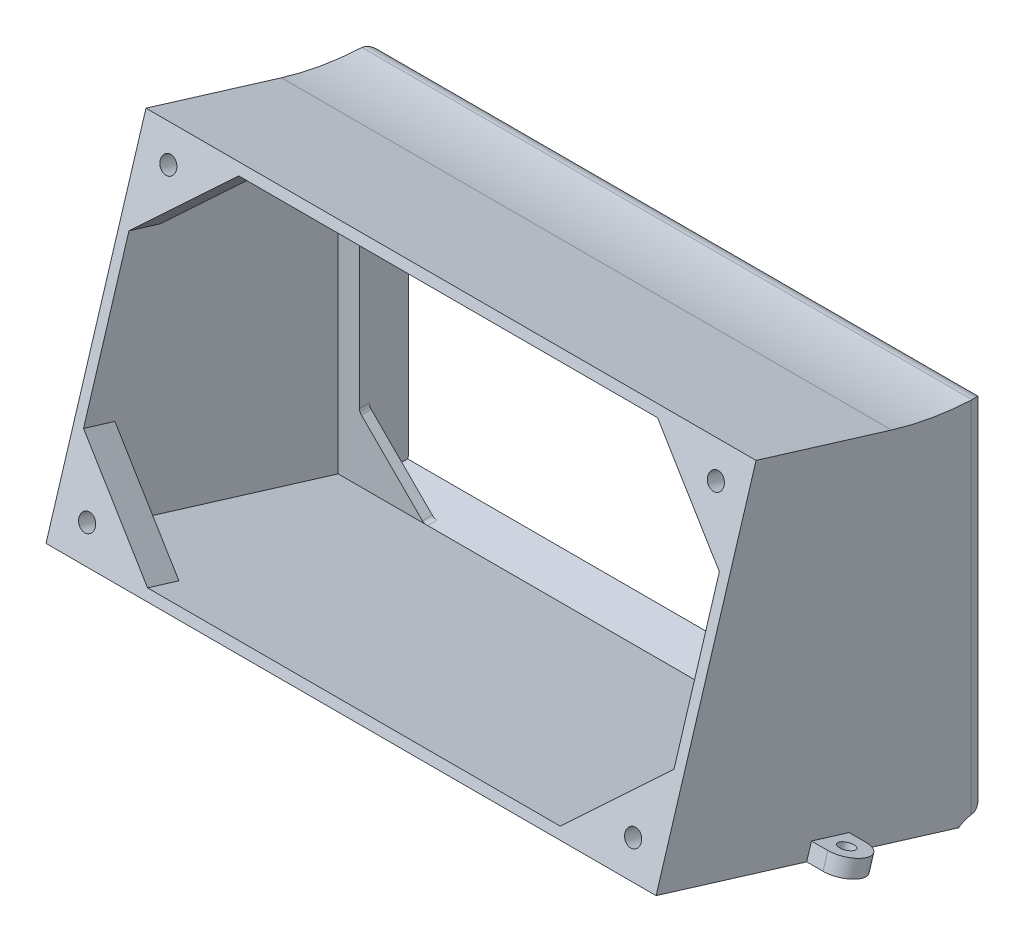
from build123d import *

# Parameters (mm, degrees)
SKETCH1_W                = 173
SKETCH1_H                = 109
SKETCH1_W_2              = 167
SKETCH1_H_2              = 103
EXTRUDE_THIN1_DEPTH      = 15
BOSS_EXTRUDE1_DEPTH      = 3
BOSS_EXTRUDE2_DEPTH      = 86.5
BOSS_EXTRUDE2_DEPTH_BACK = 86.5
MOVE_START               = 86.5
MOVE_FACE1_DEPTH         = 6.5
MOVE_START_2             = -93
MOVE_FACE2_DEPTH         = 6.5
BOSS_EXTRUDE3_START      = -93
BOSS_EXTRUDE3_DEPTH      = 186
BOSS_EXTRUDE3_2_DEPTH    = 3
BOSS_EXTRUDE3_START_2    = 90
BOSS_EXTRUDE3_3_DEPTH    = 3
FILLET3_R                = 100
FILLET2_R                = 2
SKETCH8_R                = 2.5
BOSS_EXTRUDE4_DEPTH      = 10
SKETCH8_3_R              = 2.5
CUT_EXTRUDE1_DEPTH       = 6
SKETCH9_R                = 2.25
BOSS_EXTRUDE5_DEPTH      = 5
FILLET4_R                = 5


# Read off the part's stored shape, not the designer's step: Move Face1, Move Face2, Boss-Extrude3
with BuildPart() as part:
    # Sketch1 → Extrude-Thin1 (new body)
    with BuildSketch(Plane.XY):
        Rectangle(SKETCH1_W, SKETCH1_H)
        Rectangle(SKETCH1_W_2, SKETCH1_H_2, mode=Mode.SUBTRACT)
    extrude(amount=EXTRUDE_THIN1_DEPTH)

    # Sketch2 → Boss-Extrude1 (add)
    with BuildSketch(Plane.XY.offset(15)):
        Polygon((63.701010127, 51.5), (83.5, 31.701010127), (83.5, 51.5), align=None)
        Polygon((-83.5, 51.5), (-83.5, 31.701010127), (-63.701010127, 51.5), align=None)
        Polygon((83.5, -31.701010127), (63.701010127, -51.5), (83.5, -51.5), align=None)
        Polygon((-83.5, -31.701010127), (-83.5, -51.5), (-63.701010127, -51.5), align=None)
    extrude(amount=-BOSS_EXTRUDE1_DEPTH)

    # Sketch5 → Boss-Extrude2 (add, two sides: drawn at the far end of the back side and taken through both)
    with BuildSketch(Plane(origin=(0, 0, 0), x_dir=(0, 0, -1), z_dir=(1, 0, 0)).offset(-BOSS_EXTRUDE2_DEPTH_BACK)):
        with BuildLine():
            Line((-15, -54.5), (-8.784019086, -56.400416081))
            add(Edge.make_bspline(
                [(0, -54.5), (-2.80635361, -54.592909142), (-6.451217818, -54.49036495), (-8.784019086, -56.400416081)],
                knots=[0, 0, 0, 0, 1, 1, 1, 1], degree=3))
            Line((0, -54.5), (-15, -54.5))
        make_face()
    extrude(amount=BOSS_EXTRUDE2_DEPTH + BOSS_EXTRUDE2_DEPTH_BACK)

    # Move Face1 outline → Move Face1 (add)
    with BuildSketch(Plane.YZ.offset(MOVE_START)):
        with BuildLine():
            Line((-54.5, 15), (-56.400416081, 8.784019086))
            add(Edge.make_bspline(
                [(-56.400416081, 8.784019086), (-54.49036495, 6.451217818), (-54.592909142, 2.80635361), (-54.5, 0)],
                knots=[0, 0, 0, 0, 1, 1, 1, 1], degree=3))
            Line((-54.5, 0), (54.5, 0))
            Line((54.5, 0), (54.5, 15))
            Line((54.5, 15), (-54.5, 15))
        make_face()
    extrude(amount=MOVE_FACE1_DEPTH)

    # Move Face2 outline → Move Face2 (add)
    with BuildSketch(Plane.YZ.offset(MOVE_START_2)):
        with BuildLine():
            Line((-54.5, 15), (-56.400416081, 8.784019086))
            add(Edge.make_bspline(
                [(-56.400416081, 8.784019086), (-54.49036495, 6.451217818), (-54.592909142, 2.80635361), (-54.5, 0)],
                knots=[0, 0, 0, 0, 1, 1, 1, 1], degree=3))
            Line((-54.5, 0), (54.5, 0))
            Line((54.5, 0), (54.5, 15))
            Line((54.5, 15), (-54.5, 15))
        make_face()
    extrude(amount=MOVE_FACE2_DEPTH)

    # Boss-Extrude3 outline → Boss-Extrude3 (add)
    with BuildSketch(Plane.YZ.offset(BOSS_EXTRUDE3_START)):
        Polygon((-28.186546575, 101.067428037), (-54.5, 15), (-51.362924731, 15), (-25.317632307, 100.190312923), align=None)
        Polygon((71.496001129, 70.591414798), (68.627086861, 71.468529912), (51.362924731, 15), (54.5, 15), align=None)
    extrude(amount=BOSS_EXTRUDE3_DEPTH)

    # Boss-Extrude3 2 outline → Boss-Extrude3 2 (add)
    with BuildSketch(Plane.YZ.offset(BOSS_EXTRUDE3_START)):
        Polygon((68.627086861, 71.468529912), (-25.317632307, 100.190312923), (-51.362924731, 15), (51.362924731, 15), align=None)
    extrude(amount=BOSS_EXTRUDE3_2_DEPTH)

    # Boss-Extrude3 3 outline → Boss-Extrude3 3 (add)
    with BuildSketch(Plane.YZ.offset(BOSS_EXTRUDE3_START_2)):
        Polygon((68.627086861, 71.468529912), (-25.317632307, 100.190312923), (-51.362924731, 15), (51.362924731, 15), align=None)
    extrude(amount=BOSS_EXTRUDE3_3_DEPTH)

    # Fillet3
    fillet3_edges = [part.edges().sort_by_distance(p)[0] for p in [
        (0, 54.5, 15),
    ]]
    fillet(fillet3_edges, radius=FILLET3_R)

    # Fillet2
    # the kernel refuses this fillet: 2 mm, written as the material it adds along each edge
    with BuildSketch(Plane(origin=(83.5, 31.701010127, 15), x_dir=(0, -1, 0), z_dir=(0, 0, -1)), Plane(origin=(-63.701010127, 51.5, 15), x_dir=(1, 0, 0), z_dir=(0, 0, -1)), Plane(origin=(63.701010127, -51.5, 15), x_dir=(-1, 0, 0), z_dir=(0, 0, -1)), Plane(origin=(-83.5, -31.701010127, 15), x_dir=(0, 1, 0), z_dir=(0, 0, -1))) as fillet2_piece_1:
        with BuildLine():
            CenterArc((FILLET2_R * 0.414213562373, FILLET2_R), FILLET2_R, 225, 45)
            Line((-FILLET2_R * 0.292893218813, FILLET2_R * 0.292893218813), (0, 0))
            Line((0, 0), (FILLET2_R * 0.414213562373, 0))
        make_face()
    extrude(amount=3)
    with BuildSketch(Plane(origin=(63.701010127, 51.5, 15), x_dir=(-1, 0, 0), z_dir=(0, 0, -1)), Plane(origin=(-83.5, 31.701010127, 15), x_dir=(0, -1, 0), z_dir=(0, 0, -1)), Plane(origin=(83.5, -31.701010127, 15), x_dir=(0, 1, 0), z_dir=(0, 0, -1)), Plane(origin=(-63.701010127, -51.5, 15), x_dir=(1, 0, 0), z_dir=(0, 0, -1))) as fillet2_piece_2:
        with BuildLine():
            CenterArc((FILLET2_R * 0.414213562373, -FILLET2_R), FILLET2_R, 90, 45)
            Line((-FILLET2_R * 0.292893218813, -FILLET2_R * 0.292893218813), (0, 0))
            Line((0, 0), (FILLET2_R * 0.414213562373, 0))
        make_face()
    extrude(amount=3)

    # Sketch8 → Boss-Extrude4 (add)
    # profile 1 of 8: a face of its own
    with BuildSketch(Plane(origin=(0, 25.848674053, 84.547203211), x_dir=(1, 0, 0), z_dir=(0, 0.2923717047227412, 0.9563047559630341))):
        Polygon((-90, 19.714270268), (-63.838085396, 44.733033629), (-90, 44.733033629), align=None)
        with Locations((-83.459521349, 38.478342789)):
            Circle(SKETCH8_R, mode=Mode.SUBTRACT)
    # profile 2 of 8: a face of its own
    with BuildSketch(Plane(origin=(0, 25.848674053, 84.547203211), x_dir=(1, 0, 0), z_dir=(0, 0.2923717047227412, 0.9563047559630341))):
        with Locations((-83.459521349, 38.478342789)):
            Circle(SKETCH8_R)
    # profile 3 of 8: a face of its own
    with BuildSketch(Plane(origin=(0, 25.848674053, 84.547203211), x_dir=(1, 0, 0), z_dir=(0, 0.2923717047227412, 0.9563047559630341))):
        Polygon((62.943139485, -53.504184771), (90, -53.504184771), (90, -27.608306296), (62.920893352, -53.504184771), align=None)
        with Locations((83.230223338, -47.030215152)):
            Circle(SKETCH8_R, mode=Mode.SUBTRACT)
    # profile 4 of 8: a face of its own
    with BuildSketch(Plane(origin=(0, 25.848674053, 84.547203211), x_dir=(1, 0, 0), z_dir=(0, 0.2923717047227412, 0.9563047559630341))):
        with Locations((83.230223338, -47.030215152)):
            Circle(SKETCH8_R)
    # profile 5 of 8: a face of its own
    with BuildSketch(Plane(origin=(0, 25.848674053, 84.547203211), x_dir=(1, 0, 0), z_dir=(0, 0.2923717047227412, 0.9563047559630341))):
        Polygon((-90, -53.504184771), (-62.920893352, -53.504184771), (-90, -27.608306296), align=None)
        with Locations((-83.230223338, -47.030215152)):
            Circle(SKETCH8_R, mode=Mode.SUBTRACT)
    # profile 6 of 8: a face of its own
    with BuildSketch(Plane(origin=(0, 25.848674053, 84.547203211), x_dir=(1, 0, 0), z_dir=(0, 0.2923717047227412, 0.9563047559630341))):
        with Locations((-83.230223338, -47.030215152)):
            Circle(SKETCH8_R)
    # profile 7 of 8: a face of its own
    with BuildSketch(Plane(origin=(0, 25.848674053, 84.547203211), x_dir=(1, 0, 0), z_dir=(0, 0.2923717047227412, 0.9563047559630341))):
        Polygon((63.838085396, 44.733033629), (90, 19.714270268), (90, 44.733033629), align=None)
        with Locations((83.459521349, 38.478342789)):
            Circle(SKETCH8_R, mode=Mode.SUBTRACT)
    # profile 8 of 8: a face of its own
    with BuildSketch(Plane(origin=(0, 25.848674053, 84.547203211), x_dir=(1, 0, 0), z_dir=(0, 0.2923717047227412, 0.9563047559630341))):
        with Locations((83.459521349, 38.478342789)):
            Circle(SKETCH8_R)
    extrude(amount=-BOSS_EXTRUDE4_DEPTH)

    # Sketch8<3> → Cut-Extrude1 (cut)
    with BuildSketch(Plane(origin=(0, 25.848674053, 84.547203211), x_dir=(1, 0, 0), z_dir=(0, 0.2923717047227412, 0.9563047559630341))):
        with Locations(Location((-83.459521349, 38.478342789, 0), (0, 0, 270))):
            Circle(SKETCH8_3_R)
        with Locations(Location((83.459521349, 38.478342789, 0), (0, 0, 270))):
            Circle(SKETCH8_3_R)
        with Locations(Location((-83.230223338, -47.030215152, 0), (0, 0, 270))):
            Circle(SKETCH8_3_R)
        with Locations(Location((83.230223338, -47.030215152, 0), (0, 0, 270))):
            Circle(SKETCH8_3_R)
    extrude(amount=-CUT_EXTRUDE1_DEPTH, mode=Mode.SUBTRACT)

    # Sketch9 → Boss-Extrude5 (add)
    # profile 1 of 2: a face of its own
    with BuildSketch(Plane(origin=(0, -54.035220628, 16.520224825), x_dir=(1, 0, 0), z_dir=(0, -0.956304755963037, 0.29237170472273216))):
        with BuildLine():
            Line((-98, 40.410313432), (-93, 40.410313432))
            Line((-93, 40.410313432), (-93, 28.410313432))
            Line((-93, 28.410313432), (-98, 28.410313432))
            ThreePointArc((-98, 28.410313432), (-104, 34.410313432), (-98, 40.410313432))
        make_face()
        with Locations(Location((-98, 34.410313432, 0), (0, 0, 270))):
            Circle(SKETCH9_R, mode=Mode.SUBTRACT)
    # profile 2 of 2: a face of its own
    with BuildSketch(Plane(origin=(0, -54.035220628, 16.520224825), x_dir=(1, 0, 0), z_dir=(0, -0.956304755963037, 0.29237170472273216))):
        with BuildLine():
            Line((93, 40.410313432), (98, 40.410313432))
            ThreePointArc((98, 40.410313432), (104, 34.410313432), (98, 28.410313432))
            Line((98, 28.410313432), (93, 28.410313432))
            Line((93, 28.410313432), (93, 40.410313432))
        make_face()
        with Locations(Location((98, 34.410313432, 0), (0, 0, 270))):
            Circle(SKETCH9_R, mode=Mode.SUBTRACT)
    extrude(amount=-BOSS_EXTRUDE5_DEPTH)

    # Fillet4
    # the kernel refuses this fillet: 5 mm, written as the material it takes off along each edge
    with BuildSketch(Plane(origin=(-93, -67, 0), x_dir=(1, 0, 0), z_dir=(0, 1, 0))) as fillet4_piece_1:
        with BuildLine():
            CenterArc((FILLET4_R, -FILLET4_R), FILLET4_R, 90, 90)
            Line((0, -FILLET4_R), (-FILLET4_R * 0.02, -FILLET4_R))
            Line((-FILLET4_R * 0.02, -FILLET4_R), (-FILLET4_R * 0.02, FILLET4_R * 0.02))
            Line((-FILLET4_R * 0.02, FILLET4_R * 0.02), (FILLET4_R, FILLET4_R * 0.02))
            Line((FILLET4_R, FILLET4_R * 0.02), (FILLET4_R, 0))
        make_face()
    extrude(amount=134, mode=Mode.SUBTRACT)
    with BuildSketch(Plane(origin=(86.5, -54.5, 0), x_dir=(0, 1, 0), z_dir=(-1, 0, 0)), Plane(origin=(0, -54.5, 0), x_dir=(0, 1, 0), z_dir=(-1, 0, 0))) as fillet4_piece_2:
        with BuildLine():
            CenterArc((4.719023174, -5), FILLET4_R, 90, 82.540825882)
            Line((-0.238664904, -4.350901455), (-0.337818666, -4.337919484))
            ThreePointArc((-0.337818666, -4.337919484), (-0.165294679, -2.173525325), (-0.099945242, 0.003308858))
            Line((-0.099945242, 0.003308858), (0, 0.1))
            Line((0, 0.1), (4.719023174, 0.1))
            Line((4.719023174, 0.1), (4.719023174, 0))
        make_face()
    extrude(amount=86.5, mode=Mode.SUBTRACT)
    with BuildSketch(Plane(origin=(105.208719161, 54.5, 0), x_dir=(0, -1, 0), z_dir=(-1, 0, 0))) as fillet4_piece_3:
        with BuildLine():
            CenterArc((4.883487664, 5), FILLET4_R, 182.699411552, 87.300588448)
            Line((-0.110964129, 4.764519041), (-0.610409308, 4.740970945))
            ThreePointArc((-0.610409308, 4.740970945), (-0.5, 0.054899865), (-0.5, 0))
            Line((-0.5, 0), (0, -0.5))
            Line((0, -0.5), (4.883487664, -0.5))
            Line((4.883487664, -0.5), (4.883487664, 0))
        make_face()
    extrude(amount=210.417438322, mode=Mode.SUBTRACT)
    with BuildSketch(Plane(origin=(93, -67, 0), x_dir=(-1, 0, 0), z_dir=(0, 1, 0))) as fillet4_piece_4:
        with BuildLine():
            CenterArc((FILLET4_R, FILLET4_R), FILLET4_R, 180, 90)
            Line((0, FILLET4_R), (-FILLET4_R * 0.02, FILLET4_R))
            Line((-FILLET4_R * 0.02, FILLET4_R), (-FILLET4_R * 0.02, -FILLET4_R * 0.02))
            Line((-FILLET4_R * 0.02, -FILLET4_R * 0.02), (FILLET4_R, -FILLET4_R * 0.02))
            Line((FILLET4_R, -FILLET4_R * 0.02), (FILLET4_R, 0))
        make_face()
    extrude(amount=134, mode=Mode.SUBTRACT)
    with BuildSketch(Plane(origin=(86.5, -54.5, 0), x_dir=(0, 1, 0), z_dir=(1, 0, 0)), Plane(origin=(-104.797557934, -54.5, 0), x_dir=(0, 1, 0), z_dir=(1, 0, 0))) as fillet4_piece_5:
        with BuildLine():
            CenterArc((4.719023174, 5), FILLET4_R, 187.459174119, 82.540825881)
            Line((-0.238664904, 4.350901455), (-0.337818666, 4.337919484))
            ThreePointArc((-0.337818666, 4.337919484), (-0.165294679, 2.173525325), (-0.099945242, -0.003308858))
            Line((-0.099945242, -0.003308858), (0, -0.1))
            Line((0, -0.1), (4.719023174, -0.1))
            Line((4.719023174, -0.1), (4.719023174, 0))
        make_face()
    extrude(amount=18.297557934, mode=Mode.SUBTRACT)


solid = part.part
